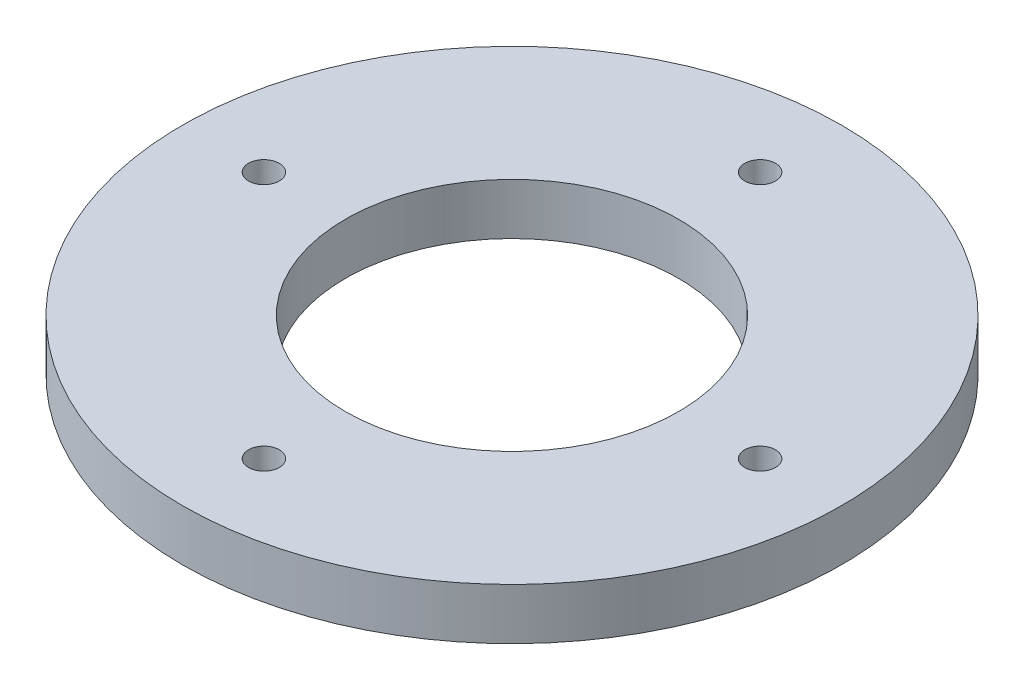
from build123d import *

# Parameters (mm, degrees)
SKETCH1_R           = 32.135
SKETCH1_R_2         = 16.25
BOSS_EXTRUDE1_DEPTH = 2.5
SKETCH2_R           = 1.5
CUT_EXTRUDE1_DEPTH  = 46.719978675
CIRPATTERN1_COUNT   = 4


with BuildPart() as part:
    # Sketch1 → Boss-Extrude1 (new, symmetric)
    with BuildSketch(Plane(origin=(0, 0, 0), x_dir=(1, 0, 0), z_dir=(0, 1, 0))):
        Circle(SKETCH1_R)
        Circle(SKETCH1_R_2, mode=Mode.SUBTRACT)
    extrude(amount=BOSS_EXTRUDE1_DEPTH, both=True)

    # Sketch2 → Cut-Extrude1 (cut, through all)
    with BuildSketch(Plane(origin=(0, 2.5, 0), x_dir=(1, 0, 0), z_dir=(0, 1, 0))):
        with Locations((0, 24.1925)):
            Circle(SKETCH2_R)
    cut_extrude1 = extrude(amount=-CUT_EXTRUDE1_DEPTH, mode=Mode.SUBTRACT)

    # CirPattern1: Cut-Extrude1 ×4 about axis
    cirpattern1_axis = Axis((0, 2.5, 0), (0, -1, 0))
    for i in range(1, CIRPATTERN1_COUNT):
        add(cut_extrude1.rotate(cirpattern1_axis, i * 360 / CIRPATTERN1_COUNT), mode=Mode.SUBTRACT)


solid = part.part
